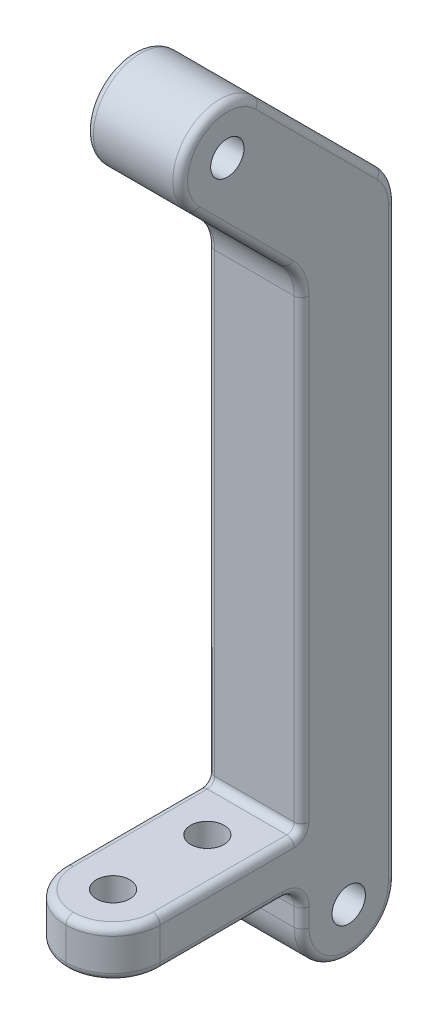
from build123d import *

# Parameters (mm, degrees)
SKETCH1_R           = 2.25
SKETCH1_R_2         = 6.35
BOSS_EXTRUDE1_DEPTH = 12.7
FILLET1_R           = 6.35
FILLET3_R           = 6.35
FILLET5_R           = 2.5
FILLET4_R           = 1
CUT_EXTRUDE1_REACH  = 104.568
SKETCH2_R           = 2.25


with BuildPart() as part:
    # Sketch1 → Boss-Extrude1 (new body)
    # profile 1 of 2: a face of its own
    with BuildSketch(Plane(origin=(0, 0, 0), x_dir=(0, 0, -1), z_dir=(1, 0, 0))):
        with BuildLine():
            Line((-6.35, 76.319743879), (-6.35, 11.3))
            Line((-6.35, 11.3), (-31.75, 11.3))
            Line((-31.75, 11.3), (-31.75, 4.95))
            Line((-31.75, 4.95), (-6.35, 4.95))
            Line((-6.35, 4.95), (-6.35, -6.35))
            Line((-6.35, -6.35), (6.35, -6.35))
            Line((6.35, -6.35), (6.35, 11.3))
            Line((6.35, 11.3), (6.35, 81.580256121))
            Line((6.35, 81.580256121), (-11.859871939, 99.790128061))
            ThreePointArc((-11.859871939, 99.790128061), (-10.483364969, 97.730039796), (-10, 95.3))
            ThreePointArc((-10, 95.3), (-13.919960204, 89.433364969), (-20.840128061, 90.809871939))
            Line((-20.840128061, 90.809871939), (-6.35, 76.319743879))
        make_face()
        Circle(SKETCH1_R, mode=Mode.SUBTRACT)
    # profile 2 of 2: a face of its own
    with BuildSketch(Plane(origin=(0, 0, 0), x_dir=(0, 0, -1), z_dir=(1, 0, 0))):
        with Locations((-16.35, 95.3)):
            Circle(SKETCH1_R_2)
        with Locations((-16.35, 95.3)):
            Circle(SKETCH1_R, mode=Mode.SUBTRACT)
    extrude(amount=BOSS_EXTRUDE1_DEPTH)

    # Fillet1
    fillet1_edges = [part.edges().sort_by_distance(p)[0] for p in [
        (6.35, 81.580256121, -6.35),
        (6.35, 76.319743879, 6.35),
        (6.35, -6.35, -6.35),
        (6.35, -6.35, 6.35),
    ]]
    fillet(fillet1_edges, radius=FILLET1_R - 0.0001)  # a hair under: the kernel refuses the full size

    # Fillet3
    fillet3_edges = [part.edges().sort_by_distance(p)[0] for p in [
        (0, 8.125, 31.75),
        (12.7, 8.125, 31.75),
    ]]
    fillet(fillet3_edges, radius=FILLET3_R - 0.0001)  # a hair under: the kernel refuses the full size

    # Fillet5
    fillet5_edges = [part.edges().sort_by_distance(p)[0] for p in [
        (6.35, 4.95, 6.35),
    ]]
    fillet(fillet5_edges, radius=FILLET5_R)

    # Fillet4
    fillet4_edges = [part.edges().sort_by_distance(p)[0] for p in [
        (12.7, 99.790128061, 20.840128061),
        (0, 11.3, 15.87505),
        (0, 42.49476459, 6.35),
        (0, 99.790128061, 20.840128061),
        (0, 91.615113416, 3.684857295),
        (12.7, 42.49476459, 6.35),
        (6.35, 11.3, 6.35),
        (12.7, 11.3, 15.87505),
        (0, 39.474970711, -6.35),
        (0, 84.494729234, 14.524985355),
        (0, -4.49015735, 4.49015735),
        (0, -4.49015735, -4.49015735),
        (0, 81.380042949, -5.866642643),
        (12.7, 39.474970711, -6.35),
        (12.7, 84.494729234, 14.524985355),
        (12.7, -4.49015735, 4.49015735),
        (12.7, -4.49015735, -4.49015735),
        (12.7, 81.380042949, -5.866642643),
        (0, 76.119530706, 6.833357357),
        (12.7, 76.119530706, 6.833357357),
        (0, 4.95, 17.12505),
        (12.7, 4.95, 17.12505),
        (10.84015735, 4.95, 29.89015735),
        (1.85984265, 4.95, 29.89015735),
        (10.84015735, 11.3, 29.89015735),
        (1.85984265, 11.3, 29.89015735),
        (12.7, 91.615113416, 3.684857295),
        (0, 1.22495, 6.35),
        (12.7, 1.22495, 6.35),
        (0, 4.217766953, 7.082233047),
        (12.7, 4.217766953, 7.082233047),
    ]]
    fillet(fillet4_edges, radius=FILLET4_R)

    # Sketch2 → Cut-Extrude1 (cut, up to next)
    with BuildSketch(Plane.XZ.offset(-4.95), mode=Mode.PRIVATE) as cut_extrude1_sk1:
        with Locations(Location((6.35, 12.7, 0), (0, 0, 270))):
            Circle(SKETCH2_R)
    cut_extrude1_tool1 = extrude(cut_extrude1_sk1.sketch, amount=-CUT_EXTRUDE1_REACH, mode=Mode.PRIVATE) & part.part
    # Sketch2 → Cut-Extrude1 (cut, up to next)
    with BuildSketch(Plane.XZ.offset(-4.95), mode=Mode.PRIVATE) as cut_extrude1_sk2:
        with Locations(Location((6.35, 25.4, 0), (0, 0, 270))):
            Circle(SKETCH2_R)
    cut_extrude1_tool2 = extrude(cut_extrude1_sk2.sketch, amount=-CUT_EXTRUDE1_REACH, mode=Mode.PRIVATE) & part.part
    add(cut_extrude1_tool1.solids().sort_by_distance((6.35, 4.95, 12.7))[0], mode=Mode.SUBTRACT)
    add(cut_extrude1_tool2.solids().sort_by_distance((6.35, 4.95, 25.4))[0], mode=Mode.SUBTRACT)


solid = part.part
